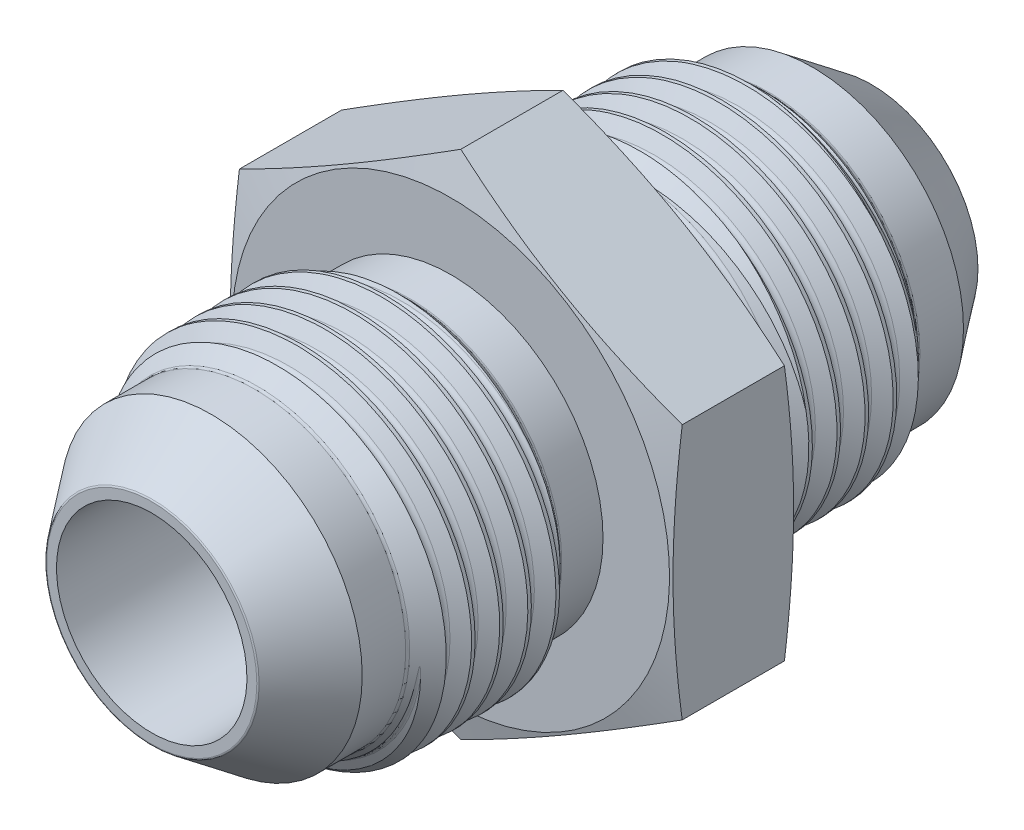
from build123d import *

# Parameters (mm, degrees)
CUT_SWEEP1_PITCH         = 1.8142857142857174
CIRPATTERN1_COUNT        = 2
CIRPATTERN1_ANGLE        = 180.0000000000004
BOSS_EXTRUDE1_DEPTH      = 3.937
BOSS_EXTRUDE1_DEPTH_BACK = 3.937
CIRPATTERN2_COUNT        = 2
CIRPATTERN2_ANGLE        = 180.0000000000004


with BuildPart() as part:
    # Sketch1 → Revolve1 (revolve)
    with BuildSketch(Plane(origin=(0, 0, 0), x_dir=(0, 0, -1), z_dir=(1, 0, 0)), mode=Mode.PRIVATE) as revolve1_sk:
        with BuildLine():
            Line((-23.241, 0), (0, 0))
            Line((0, 0), (-2.2e-16, 9.8171))
            Line((-2.2e-16, 9.8171), (-6.600389755157237, 9.8171))
            ThreePointArc((-6.600389755157237, 9.8171), (-6.697591346977969, 9.836434598742136), (-6.779994877578618, 9.89149487757862))
            Line((-6.779994877578618, 9.89149487757862), (-8.001000000000005, 11.112499999999999))
            Line((-8.001000000000005, 11.112499999999999), (-15.113000000000012, 11.112499999999999))
            Line((-15.113000000000012, 11.112499999999999), (-16.410205122421385, 9.815294877578618))
            ThreePointArc((-16.410205122421385, 9.815294877578618), (-16.492608653022035, 9.760234598742136), (-16.58981024484277, 9.740900000000002))
            Line((-16.58981024484277, 9.740900000000002), (-19.398409014515956, 9.7409))
            Line((-19.398409014515956, 9.7409), (-23.190430507940313, 6.883406845553223))
            ThreePointArc((-23.190430507940313, 6.883406845553223), (-23.227656663923458, 6.838647258042162), (-23.241, 6.781980135777218))
            Line((-23.241, 6.781980135777218), (-23.241, 0))
        make_face()
    revolve(revolve1_sk.sketch.rotate(Axis((0, 0, 19.812), (0, 0, -1)), 90), axis=Axis((0, 0, 19.812), (0, 0, -1)))

    # Cut-Sweep1: the profile of Sketch3 screwed along a right-hand helix of 11.612 turns, 10 arcs to a turn; built about Z, then put on its axis
    cut_sweep1_z = Axis((0, 0, 0), (0, 0, 1))
    cut_sweep1_corners = [(11.210701095, 0, -1.644196429), (10.228690146, 0, -1.077232143), (10.065021654, 0, -0.79375), (10.228690146, 0, -0.510267857), (11.210701095, 0, 0.056696429)]
    with BuildLine(mode=Mode.PRIVATE) as cut_sweep1_profile:
        Line(cut_sweep1_corners[0], cut_sweep1_corners[1])
        Line(cut_sweep1_corners[3], cut_sweep1_corners[4])
        Line(cut_sweep1_corners[4], cut_sweep1_corners[0])
        ThreePointArc((10.228690146, 0, -1.077232143), (10.108876495, 0, -0.957418491), (10.065021654, 0, -0.79375))
        ThreePointArc((10.065021654, 0, -0.79375), (10.108876495, 0, -0.630081509), (10.228690146, 0, -0.510267857))
    cut_sweep1_cap = Face(cut_sweep1_profile.wire())
    cut_sweep1_arcs = [((10.228690146, 0, -1.077232143), (10.065021654, 0, -0.982738095), (10.065021654, 0, -0.79375), (1, 0.8660254037844399, 1)), ((10.065021654, 0, -0.79375), (10.065021654, 0, -0.604761905), (10.228690146, 0, -0.510267857), (1, 0.8660254037844399, 1))]  # start, shoulder, end, weights
    cut_sweep1_turn_angles = [0, 18, 36, 54, 72, 90, 108, 126, 144, 162, 180, 198, 216, 234, 252, 270, 288, 306, 324, 342, 360]
    cut_sweep1_turn_weights = [1, 0.9510565162951535, 1, 0.9510565162951535, 1, 0.9510565162951535, 1, 0.9510565162951535, 1, 0.9510565162951535, 1, 0.9510565162951535, 1, 0.9510565162951535, 1, 0.9510565162951535, 1, 0.9510565162951535, 1, 0.9510565162951535, 1]
    cut_sweep1_turn_rails = [Edge.make_bspline([Vector(p[0], p[1], 0).rotate(cut_sweep1_z, cut_sweep1_turn_angles[k]) / cut_sweep1_turn_weights[k] + Vector(0, 0, p[2] + CUT_SWEEP1_PITCH * cut_sweep1_turn_angles[k] / 360) for k in range(21)], [0, 0, 0, 1, 1, 2, 2, 3, 3, 4, 4, 5, 5, 6, 6, 7, 7, 8, 8, 9, 9, 10, 10, 10], 2, cut_sweep1_turn_weights) for p in cut_sweep1_corners]
    cut_sweep1_turn_sides = [*[Face.make_surface_from_curves(cut_sweep1_turn_rails[p[0]], cut_sweep1_turn_rails[p[1]]) for p in [(0, 1), (3, 4), (4, 0)]], *[Face.make_bezier_surface([[Vector(p[j][0], p[j][1], 0).rotate(cut_sweep1_z, cut_sweep1_turn_angles[2 * i + k]) / cut_sweep1_turn_weights[2 * i + k] + Vector(0, 0, p[j][2] + CUT_SWEEP1_PITCH * cut_sweep1_turn_angles[2 * i + k] / 360) for k in range(3)] for j in range(3)], [[p[3][j] * cut_sweep1_turn_weights[2 * i + k] for k in range(3)] for j in range(3)]) for p in cut_sweep1_arcs for i in range(10)]]
    cut_sweep1_last_angles = [3960, 3978, 3996, 4014, 4032, 4050, 4068, 4086, 4104, 4122, 4140, 4158, 4176, 4178.160000001, 4180.320000002]
    cut_sweep1_last_weights = [1, 0.9510565162951535, 1, 0.9510565162951535, 1, 0.9510565162951535, 1, 0.9510565162951535, 1, 0.9510565162951535, 1, 0.9510565162951535, 1, 0.9992894726398815, 1]
    cut_sweep1_last_rails = [Edge.make_bspline([Vector(p[0], p[1], 0).rotate(cut_sweep1_z, cut_sweep1_last_angles[k]) / cut_sweep1_last_weights[k] + Vector(0, 0, p[2] + CUT_SWEEP1_PITCH * cut_sweep1_last_angles[k] / 360) for k in range(15)], [0, 0, 0, 1, 1, 2, 2, 3, 3, 4, 4, 5, 5, 6, 6, 7, 7, 7], 2, cut_sweep1_last_weights) for p in cut_sweep1_corners]
    cut_sweep1_last_sides = [*[Face.make_surface_from_curves(cut_sweep1_last_rails[p[0]], cut_sweep1_last_rails[p[1]]) for p in [(0, 1), (3, 4), (4, 0)]], *[Face.make_bezier_surface([[Vector(p[j][0], p[j][1], 0).rotate(cut_sweep1_z, cut_sweep1_last_angles[2 * i + k]) / cut_sweep1_last_weights[2 * i + k] + Vector(0, 0, p[j][2] + CUT_SWEEP1_PITCH * cut_sweep1_last_angles[2 * i + k] / 360) for k in range(3)] for j in range(3)], [[p[3][j] * cut_sweep1_last_weights[2 * i + k] for k in range(3)] for j in range(3)]) for p in cut_sweep1_arcs for i in range(7)]]
    cut_sweep1 = Plane(origin=(0, 0, 23.241), x_dir=(-3.49e-15, 1, 0), z_dir=(0, 0, -1)) * Solid(Shell([*[p.moved(Location((0, 0, CUT_SWEEP1_PITCH * i))) for i in range(11) for p in cut_sweep1_turn_sides], *cut_sweep1_last_sides, cut_sweep1_cap, cut_sweep1_cap.rotate(cut_sweep1_z, 4180.320000002).moved(Location((0, 0, CUT_SWEEP1_PITCH * 4180.320000002 / 360)))]))
    add(cut_sweep1, mode=Mode.SUBTRACT)


with BuildPart() as cirpattern1_1:
    # CirPattern1: pattern copy
    add(part.part.rotate(Axis((-10.477500000000001, 0, 0), (1, 0, 0)), 1 * CIRPATTERN1_ANGLE / (CIRPATTERN1_COUNT - 1)))


with BuildPart() as part_1:
    add(part.part)

    add(cirpattern1_1.part)  # Boss-Extrude1 merges CirPattern1_1
    # Sketch4 → Boss-Extrude1 (add, two sides: drawn at the far end of the back side and taken through both)
    with BuildSketch(Plane.XY.offset(-BOSS_EXTRUDE1_DEPTH_BACK)):
        Polygon((0, 16.497783942093555), (-14.2875, 8.248891971046783), (-14.2875, -8.24889197104678), (1.89e-15, -16.497783942093555), (14.287500000000005, -8.248891971046778), (14.287500000000005, 8.248891971046778), align=None)
    extrude(amount=BOSS_EXTRUDE1_DEPTH + BOSS_EXTRUDE1_DEPTH_BACK)

    # Sketch5 → Cut-Revolve1 (revolve, cut)
    with BuildSketch(Plane(origin=(0, 0, 0), x_dir=(0, 0, -1), z_dir=(1, 0, 0)), mode=Mode.PRIVATE) as cut_revolve1_sk:
        Polygon((-3.937000000000002, 18.88586788418711), (3.937000000000003, 18.88586788418711), (3.937000000000003, 14.1097), (3.297114836258333, 16.49778394209356), (-3.29711483625832, 16.497783942093555), (-3.937000000000002, 14.1097), align=None)
    revolve(cut_revolve1_sk.sketch.rotate(Axis((0, -1.1e-16, 3.987800000000003), (0, 3e-17, -1)), 180), axis=Axis((0, -1.1e-16, 3.987800000000003), (0, 3e-17, -1)), mode=Mode.SUBTRACT)

    # Sketch6 → Cut-Revolve2 (revolve, cut)
    with BuildSketch(Plane(origin=(0, 0, 0), x_dir=(0, 0, -1), z_dir=(1, 0, 0)), mode=Mode.PRIVATE) as cut_revolve2_sk:
        with BuildLine():
            Line((-23.241, 6.1468), (0, 6.1468))
            ThreePointArc((0, 6.1468), (4.346443962597471, 4.34644396259747), (6.1468, 1.4e-16))
            Line((6.1468, 1.4e-16), (-23.241, -3.47e-15))
            Line((-23.241, -3.47e-15), (-23.241, 6.1468))
        make_face()
    cut_revolve2 = revolve(cut_revolve2_sk.sketch.rotate(Axis((0, 1.4e-16, -6.1468), (0, -1.2e-16, 1)), 31.07737195), axis=Axis((0, 1.4e-16, -6.1468), (0, -1.2e-16, 1)), mode=Mode.SUBTRACT)

    # CirPattern2: Cut-Revolve2 ×2 about axis
    cirpattern2_axis = Axis((-10.477500000000001, 0, 0), (1, 0, 0))
    for i in range(1, CIRPATTERN2_COUNT):
        add(cut_revolve2.rotate(cirpattern2_axis, i * CIRPATTERN2_ANGLE / (CIRPATTERN2_COUNT - 1)), mode=Mode.SUBTRACT)


solid = part_1.part
